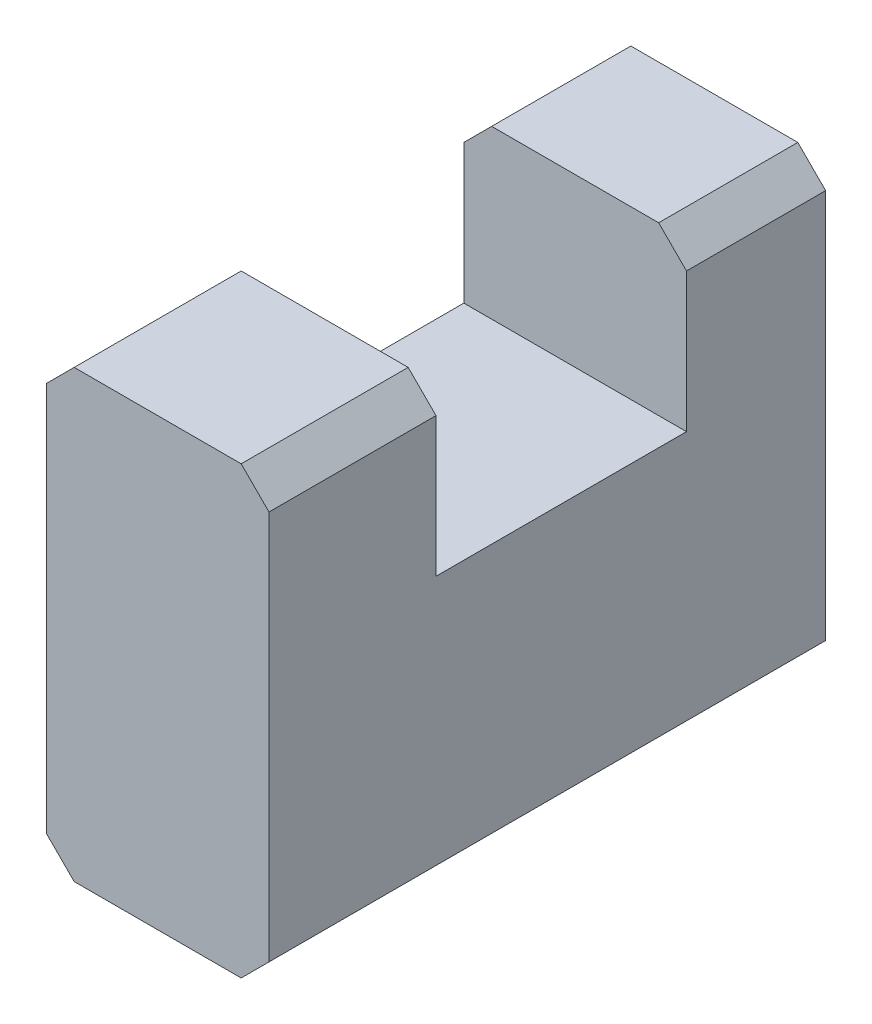
from build123d import *

# Parameters (mm, degrees)
SKETCH1_W               = 4
SKETCH1_H               = 8
BOSS_EXTRUDE1_DEPTH     = 10
CHAMFER1_SIZE           = 0.5
CUT_EXTRUDE1_DEPTH      = 11.95445115
CUT_EXTRUDE1_DEPTH_BACK = 11.95445115
SKETCH2_W               = 4.5
SKETCH2_H               = 3


with BuildPart() as part:
    # Sketch1 → Boss-Extrude1 (new body)
    with BuildSketch(Plane.XY):
        Rectangle(SKETCH1_W, SKETCH1_H)
    extrude(amount=BOSS_EXTRUDE1_DEPTH)

    # Chamfer1
    chamfer1_edges = [part.edges().sort_by_distance(p)[0] for p in [
        (-2, -4, 5),
        (2, -4, 5),
        (2, 4, 5),
        (-2, 4, 5),
    ]]
    chamfer(chamfer1_edges, length=CHAMFER1_SIZE)

    # Sketch2 → Cut-Extrude1 (cut, two sides: drawn at the far end of the back side and taken through both)
    with BuildSketch(Plane(origin=(0, 0, 0), x_dir=(0, 0, -1), z_dir=(1, 0, 0)).offset(-CUT_EXTRUDE1_DEPTH_BACK)):
        with Locations((-4.75, 2.5)):
            Rectangle(SKETCH2_W, SKETCH2_H)
    extrude(amount=CUT_EXTRUDE1_DEPTH + CUT_EXTRUDE1_DEPTH_BACK, mode=Mode.SUBTRACT)


solid = part.part
